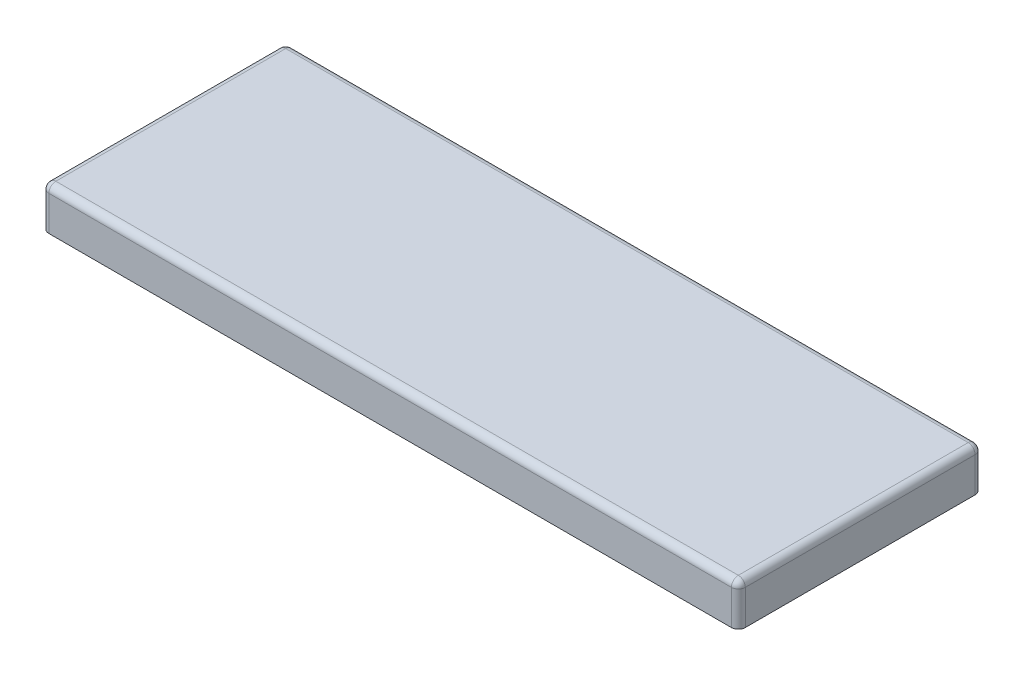
from build123d import *

# Parameters (mm, degrees)
RECTANGLEBOX_DEPTH      = 2
RECTANGLEBOX_DEPTH_BACK = 10
SKETCHREC_W             = 200
SKETCHREC_H             = 70
RECTANGLER_R            = 2
RECTANGLEC_START        = -98
RECTANGLEC_OUTLINE_W    = 10
RECTANGLEC_OUTLINE_H    = 66
RECTANGLEC_DEPTH        = 196


# Read off the part's stored shape, not the designer's step: RectangleC
with BuildPart() as part:
    # SketchRec → RectangleBox (new, two sides: drawn at the far end of the back side and taken through both)
    with BuildSketch(Plane(origin=(0, 0, 0), x_dir=(1, 0, 0), z_dir=(0, 1, 0)).offset(-RECTANGLEBOX_DEPTH_BACK)):
        Rectangle(SKETCHREC_W, SKETCHREC_H)
    extrude(amount=RECTANGLEBOX_DEPTH + RECTANGLEBOX_DEPTH_BACK)

    # RectangleR
    rectangler_edges = [part.edges().sort_by_distance(p)[0] for p in [
        (100, 2, 0),
        (0, 2, -35),
        (-100, 2, 0),
        (0, 2, 35),
        (100, -4, 35),
        (-100, -4, 35),
        (-100, -4, -35),
        (100, -4, -35),
    ]]
    fillet(rectangler_edges, radius=RECTANGLER_R)

    # RectangleC outline → RectangleC (cut)
    with BuildSketch(Plane.YZ.offset(RECTANGLEC_START)):
        with Locations((-5, 0)):
            Rectangle(RECTANGLEC_OUTLINE_W, RECTANGLEC_OUTLINE_H)
    extrude(amount=RECTANGLEC_DEPTH, mode=Mode.SUBTRACT)


solid = part.part
